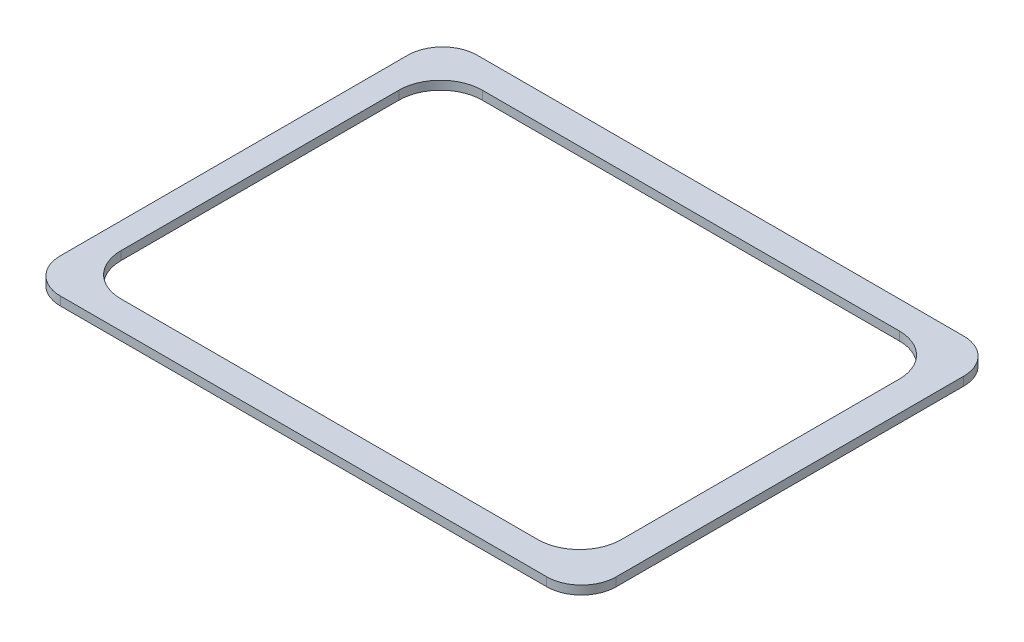
from build123d import *

# Parameters (mm, degrees)
FRONTFACE_DEPTH = 3.175


with BuildPart() as part:
    # Sketch1 → FrontFace (new body)
    with BuildSketch(Plane(origin=(0, 6.35, 0), x_dir=(1, 0, 0), z_dir=(0, 1, 0))):
        with BuildLine():
            Line((101.6, -63.5), (101.6, 63.5))
            ThreePointArc((101.6, 63.5), (97.880256121, 72.480256121), (88.9, 76.2))
            Line((88.9, 76.2), (-88.9, 76.2))
            ThreePointArc((-88.9, 76.2), (-97.880256121, 72.480256121), (-101.6, 63.5))
            Line((-101.6, 63.5), (-101.6, -63.5))
            ThreePointArc((-101.6, -63.5), (-97.880256121, -72.480256121), (-88.9, -76.2))
            Line((-88.9, -76.2), (88.9, -76.2))
            ThreePointArc((88.9, -76.2), (97.880256121, -72.480256121), (101.6, -63.5))
        make_face()
        with BuildLine():
            Line((90.75, -50.8), (90.75, 0))
            Line((90.75, 0), (90.75, 50.8))
            ThreePointArc((90.75, 50.8), (86.283378413, 61.583378413), (75.5, 66.05))
            Line((75.5, 66.05), (-76.9, 66.05))
            ThreePointArc((-76.9, 66.05), (-87.683378413, 61.583378413), (-92.15, 50.8))
            Line((-92.15, 50.8), (-92.15, -50.8))
            ThreePointArc((-92.15, -50.8), (-87.683378413, -61.583378413), (-76.9, -66.05))
            Line((-76.9, -66.05), (75.5, -66.05))
            ThreePointArc((75.5, -66.05), (86.283378413, -61.583378413), (90.75, -50.8))
        make_face(mode=Mode.SUBTRACT)
    extrude(amount=FRONTFACE_DEPTH)


solid = part.part
